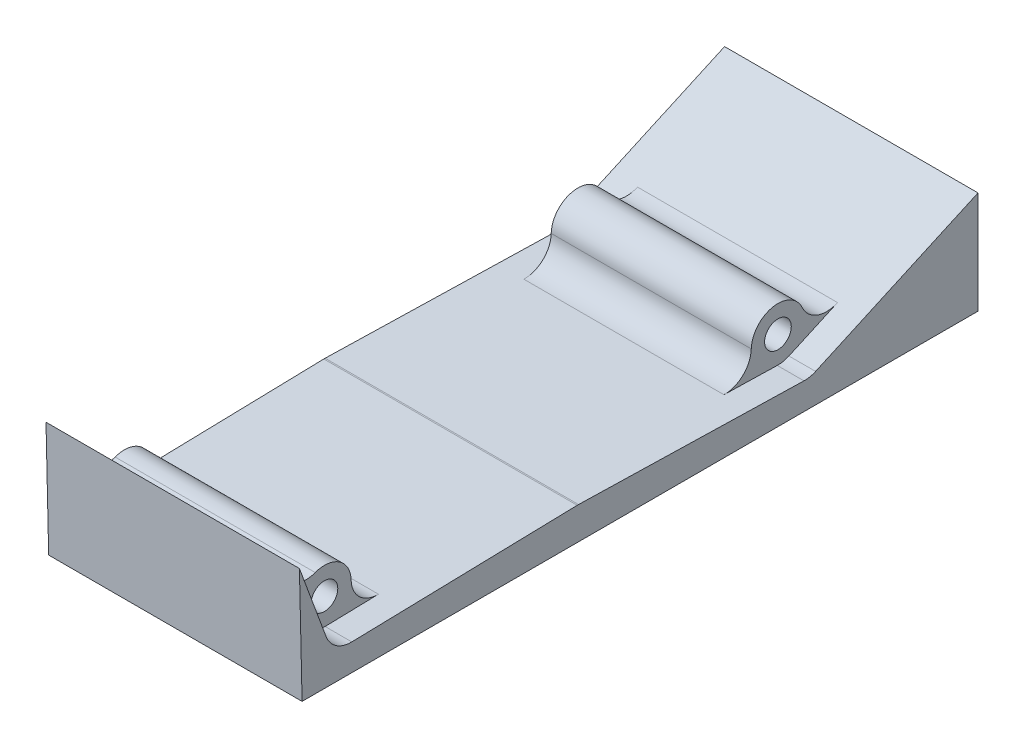
from build123d import *

# Parameters (mm, degrees)
BOSS_EXTRUDE1_DEPTH = 60.324999999999996
SKETCH2_R           = 6.349999999999996
SKETCH2_R_2         = 3.174999999999997
SKETCH2_R_3         = 6.350000000000003
BOSS_EXTRUDE2_DEPTH = 23.8125
FILLET1_R           = 6.35
SHELL1_START        = 3.175
SHELL1_DEPTH        = 53.975
SHELL1_START_2      = 9.525
SHELL1_2_DEPTH      = 41.275


# Read off the part's stored shape, not the designer's step: Shell1
with BuildPart() as part:
    # Sketch1 → Boss-Extrude1 (new body)
    with BuildSketch(Plane(origin=(0, 0, 0), x_dir=(0, 0, -1), z_dir=(1, 0, 0))):
        with BuildLine():
            Line((95.25, -46.808484128263686), (56.59005614988863, -64.27972260468273))
            ThreePointArc((56.59005614988863, -64.27972260468273), (55.235212183230196, -64.71688198003586), (53.81702677554687, -64.84122281357011))
            Line((53.81702677554687, -64.84122281357011), (0.1579732244523257, -63.50589713864123))
            ThreePointArc((0.1579732244523257, -63.50589713864123), (-7.8219e-13, -63.5039318313911), (-0.15797322445388826, -63.50589713864123))
            Line((-0.15797322445388826, -63.50589713864123), (-53.817026775546886, -64.84122281357013))
            ThreePointArc((-53.817026775546886, -64.84122281357013), (-57.54105224821803, -63.747307586818266), (-59.93275370705406, -60.69038423543624))
            Line((-59.93275370705406, -60.69038423543624), (-66.28275370705404, -43.47219611461599))
            Line((-66.28275370705404, -43.47219611461599), (-65.6463, -71.1931881208203))
            Line((-65.6463, -71.1931881208203), (95.25, -71.19318812082028))
            Line((95.25, -71.19318812082028), (95.25, -46.808484128263686))
        make_face()
    extrude(amount=BOSS_EXTRUDE1_DEPTH)

    # Sketch2 → Boss-Extrude2 (add, symmetric)
    # profile 1 of 2: a face of its own
    with BuildSketch(Plane(origin=(30.162499999999998, 0, 0), x_dir=(0, 0, -1), z_dir=(1, 0, 0))):
        with Locations((-53.975, -58.49318812082027)):
            Circle(SKETCH2_R)
        with Locations((-53.975, -58.49318812082027)):
            Circle(SKETCH2_R_2, mode=Mode.SUBTRACT)
    # profile 2 of 2: a face of its own
    with BuildSketch(Plane(origin=(30.162499999999998, 0, 0), x_dir=(0, 0, -1), z_dir=(1, 0, 0))):
        with Locations((53.97499999999999, -58.49318812082027)):
            Circle(SKETCH2_R_3)
        with Locations((53.97499999999999, -58.49318812082027)):
            Circle(SKETCH2_R_2, mode=Mode.SUBTRACT)
    extrude(amount=BOSS_EXTRUDE2_DEPTH, both=True)

    # Fillet1
    fillet1_edges = [part.edges().sort_by_distance(p)[0] for p in [
        (30.162499999999998, -60.69038423543624, 59.93275370705406),
        (30.162499999999998, -64.84122281357013, 53.817026775546886),
        (30.162499999999998, -64.27972260468273, -56.59005614988863),
        (30.162499999999998, -64.84122281357011, -53.81702677554687),
    ]]
    fillet(fillet1_edges, radius=FILLET1_R)

    # Shell1 outline → Shell1 (cut)
    with BuildSketch(Plane.YZ.offset(SHELL1_START)):
        with BuildLine():
            Line((-66.679914485, 0.078986612), (-68.01524016, 53.738040163))
            ThreePointArc((-68.01524016, 53.738040163), (-66.547807009, 59.059165573), (-62.375448989, 62.672912138))
            Line((-62.375448989, 62.672912138), (-71.193188121, 62.470463295))
            Line((-71.193188121, 62.470463295), (-71.193188121, -92.075))
            Line((-71.193188121, -92.075), (-51.727499707, -92.075))
            Line((-51.727499707, -92.075), (-67.172989847, -57.897584225))
            ThreePointArc((-67.172989847, -57.897584225), (-67.82872891, -55.865318275), (-68.01524016, -53.738040163))
            Line((-68.01524016, -53.738040163), (-66.679914485, -0.078986612))
            ThreePointArc((-66.679914485, -0.078986612), (-66.678931831, 0), (-66.679914485, 0.078986612))
        make_face()
    extrude(amount=SHELL1_DEPTH, mode=Mode.SUBTRACT)

    # Shell1 2 outline → Shell1 2 (cut)
    with BuildSketch(Plane.YZ.offset(SHELL1_START_2)):
        with BuildLine():
            ThreePointArc((-67.699293711, 41.041970778), (-66.500168266, 45.910832805), (-62.99442515, 49.496008461))
            ThreePointArc((-62.99442515, 49.496008461), (-63.747307587, 57.541052248), (-55.99280194, 59.811999995))
            ThreePointArc((-55.99280194, 59.811999995), (-55.617794314, 61.369720704), (-54.986992393, 62.842545699))
            Line((-54.986992393, 62.842545699), (-62.375448989, 62.672912138))
            ThreePointArc((-62.375448989, 62.672912138), (-66.547807009, 59.059165573), (-68.01524016, 53.738040163))
            Line((-68.01524016, 53.738040163), (-67.699293711, 41.041970778))
        make_face()
        with BuildLine():
            ThreePointArc((-62.99442515, -49.496008461), (-66.500168266, -45.910832805), (-67.699293711, -41.041970778))
            Line((-67.699293711, -41.041970778), (-68.01524016, -53.738040163))
            ThreePointArc((-68.01524016, -53.738040163), (-67.82872891, -55.865318275), (-67.172989847, -57.897584225))
            Line((-67.172989847, -57.897584225), (-61.942877547, -69.470653193))
            ThreePointArc((-61.942877547, -69.470653193), (-62.732304839, -64.518832939), (-60.897427959, -59.85225538))
            ThreePointArc((-60.897427959, -59.85225538), (-64.71688198, -55.235212183), (-62.99442515, -49.496008461))
        make_face()
    extrude(amount=SHELL1_2_DEPTH, mode=Mode.SUBTRACT)


solid = part.part
